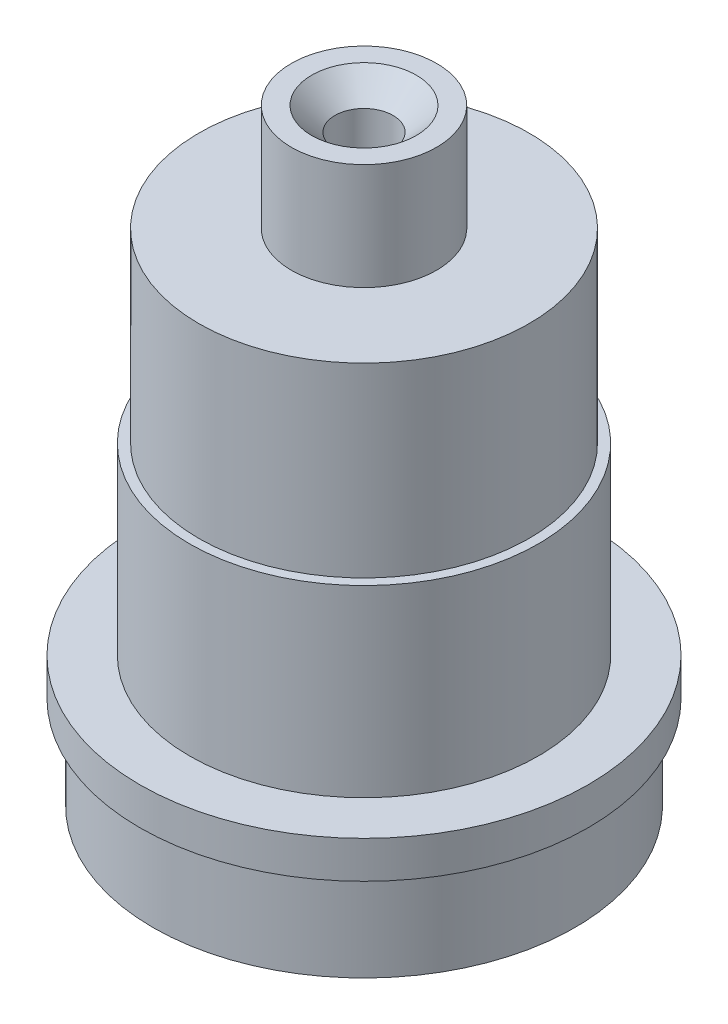
from build123d import *

# Parameters (mm, degrees)
SKETCH1_R           = 23.0505
BOSS_EXTRUDE1_DEPTH = 10.16
SKETCH2_R           = 24.4856
BOSS_EXTRUDE2_DEPTH = 4.064
SKETCH3_R           = 19.05
BOSS_EXTRUDE3_DEPTH = 20.066
SKETCH4_R           = 18.034
BOSS_EXTRUDE4_DEPTH = 20.32
SKETCH5_R           = 7.9375
BOSS_EXTRUDE5_DEPTH = 11.6332
SKETCH7_R           = 3.175
CUT_EXTRUDE1_DEPTH  = 17.018
CHAMFER1_SIZE       = 2.54


with BuildPart() as part:
    # Sketch1 → Boss-Extrude1 (new body)
    with BuildSketch(Plane(origin=(0, 0, 0), x_dir=(1, 0, 0), z_dir=(0, 1, 0))):
        Circle(SKETCH1_R)
    extrude(amount=BOSS_EXTRUDE1_DEPTH)

    # Sketch2 → Boss-Extrude2 (add)
    with BuildSketch(Plane(origin=(0, 10.16, 0), x_dir=(1, 0, 0), z_dir=(0, 1, 0))):
        Circle(SKETCH2_R)
    extrude(amount=BOSS_EXTRUDE2_DEPTH)

    # Sketch3 → Boss-Extrude3 (add)
    with BuildSketch(Plane(origin=(0, 14.224, 0), x_dir=(1, 0, 0), z_dir=(0, 1, 0))):
        Circle(SKETCH3_R)
    extrude(amount=BOSS_EXTRUDE3_DEPTH)

    # Sketch4 → Boss-Extrude4 (add)
    with BuildSketch(Plane(origin=(0, 34.29, 0), x_dir=(1, 0, 0), z_dir=(0, 1, 0))):
        Circle(SKETCH4_R)
    extrude(amount=BOSS_EXTRUDE4_DEPTH)

    # Sketch5 → Boss-Extrude5 (add)
    with BuildSketch(Plane(origin=(0, 54.61, 0), x_dir=(1, 0, 0), z_dir=(0, 1, 0))):
        Circle(SKETCH5_R)
    extrude(amount=BOSS_EXTRUDE5_DEPTH)

    # Sketch7 → Cut-Extrude1 (cut)
    with BuildSketch(Plane(origin=(0, 66.2432, 0), x_dir=(1, 0, 0), z_dir=(0, 1, 0))):
        Circle(SKETCH7_R)
    extrude(amount=-CUT_EXTRUDE1_DEPTH, mode=Mode.SUBTRACT)

    # Chamfer1
    chamfer1_edges = [part.edges().sort_by_distance(p)[0] for p in [
        (-3.175, 66.2432, 0),
    ]]
    chamfer(chamfer1_edges, length=CHAMFER1_SIZE)


solid = part.part
